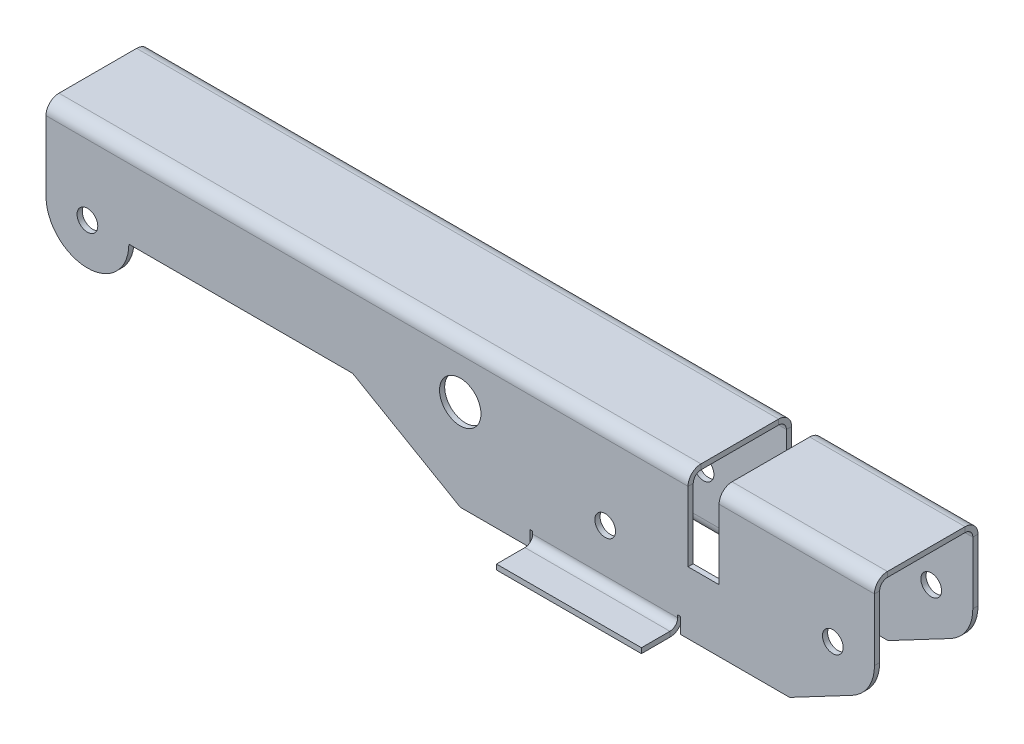
from build123d import *

# Parameters (mm, degrees)
SKETCH1_W                      = 508
SKETCH1_H                      = 63.5
BASE_FLANGE1_DEPTH             = 3.175
EDGE_FLANGE1_STRIP_W           = 22.2504
EDGE_FLANGE1_STRIP_H           = 3.175
EDGE_FLANGE1_STRIP_CUT_DEPTH   = 508
EDGE_FLANGE1_STRIP_2_W         = 22.2504
EDGE_FLANGE1_STRIP_2_H         = 3.175
EDGE_FLANGE1_STRIP_CUT_2_DEPTH = 508
EDGE_FLANGE1_DEPTH             = 508
EDGE_FLANGE1_BEND_DEPTH        = 508
SKETCH12_R                     = 12.7
CUT_EXTRUDE1_DEPTH             = 277.498571425
SKETCH13_R                     = 6.35
CUT_EXTRUDE2_DEPTH             = 277.498571425
CUT_EXTRUDE4_DEPTH             = 277.498571425
SKETCH16_R                     = 6.35
CUT_EXTRUDE5_DEPTH             = 277.498571425
CUT_EXTRUDE6_DEPTH             = 277.498571425
SKETCH18_R                     = 6.35
CUT_EXTRUDE8_DEPTH             = 277.498571425
SKETCH22_W                     = 19.05
SKETCH22_H                     = 50.682224045
CUT_EXTRUDE9_DEPTH             = 277.498571425
EDGE_FLANGE2_STRIP_W           = 22.2504
EDGE_FLANGE2_STRIP_H           = 3.175
EDGE_FLANGE2_STRIP_CUT_DEPTH   = 88.9
EDGE_FLANGE2_RELIEF_W          = 23.8379
EDGE_FLANGE2_RELIEF_H          = 1.5875
EDGE_FLANGE2_RELIEF_CUT_DEPTH  = 3.175
EDGE_FLANGE2_DEPTH             = 88.9


# Sheet-metal steps are written as plain solids
with BuildPart() as part:
    # Sketch1 → Base-Flange1 (new body)
    with BuildSketch(Plane(origin=(0, 0, 0), x_dir=(1, 0, 0), z_dir=(0, 1, 0))):
        Rectangle(SKETCH1_W, SKETCH1_H)
    extrude(amount=-BASE_FLANGE1_DEPTH)

    # Edge-Flange1 strip (across the edge) → Edge-Flange1 strip cut (cut)
    with BuildSketch(Plane(origin=(254, -3.175, 31.75), x_dir=(0, 0, -1), z_dir=(-1, 0, 0))):
        with Locations((-3.175, -1.5875)):
            Rectangle(EDGE_FLANGE1_STRIP_W, EDGE_FLANGE1_STRIP_H)
    extrude(amount=EDGE_FLANGE1_STRIP_CUT_DEPTH, mode=Mode.SUBTRACT)

    # Edge-Flange1 strip 2 (across the edge) → Edge-Flange1 strip cut 2 (cut)
    with BuildSketch(Plane(origin=(-254, -3.175, -31.75), x_dir=(0, 0, 1), z_dir=(1, 0, 0))):
        with Locations((-3.175, -1.5875)):
            Rectangle(EDGE_FLANGE1_STRIP_2_W, EDGE_FLANGE1_STRIP_2_H)
    extrude(amount=EDGE_FLANGE1_STRIP_CUT_2_DEPTH, mode=Mode.SUBTRACT)

    # Edge-Flange1 section (across the edge) → Edge-Flange1 (add)
    with BuildSketch(Plane(origin=(254, -3.175, 31.75), x_dir=(0, 0, -1), z_dir=(-1, 0, 0))):
        with BuildLine():
            Line((0, 4.7752), (0, 85.725))
            Line((0, 85.725), (3.175, 85.725))
            Line((3.175, 85.725), (3.175, 4.7752))
            ThreePointArc((3.175, 4.7752), (4.573623698, 1.398623698), (7.9502, 0))
            Line((7.9502, 0), (7.9502, -3.175))
            ThreePointArc((7.9502, -3.175), (2.328559668, -0.846440332), (0, 4.7752))
        make_face()
    extrude(amount=EDGE_FLANGE1_DEPTH)

    # Edge-Flange1 section 2 (across the edge) → Edge-Flange1 bend (add)
    with BuildSketch(Plane(origin=(-254, -3.175, -31.75), x_dir=(0, 0, 1), z_dir=(1, 0, 0))):
        with BuildLine():
            Line((0, 4.7752), (0, 85.725))
            Line((0, 85.725), (3.175, 85.725))
            Line((3.175, 85.725), (3.175, 4.7752))
            ThreePointArc((3.175, 4.7752), (4.573623698, 1.398623698), (7.9502, 0))
            Line((7.9502, 0), (7.9502, -3.175))
            ThreePointArc((7.9502, -3.175), (2.328559668, -0.846440332), (0, 4.7752))
        make_face()
    extrude(amount=EDGE_FLANGE1_BEND_DEPTH)

    # Sketch12 → Cut-Extrude1 (cut, through all)
    with BuildSketch(Plane.XY.offset(31.75)):
        with Locations((0, -33.02)):
            Circle(SKETCH12_R)
    extrude(amount=-CUT_EXTRUDE1_DEPTH, mode=Mode.SUBTRACT)

    # Sketch13 → Cut-Extrude2 (cut, through all)
    with BuildSketch(Plane.XY.offset(31.75)):
        with Locations((88.9, -54.166128078)):
            Circle(SKETCH13_R)
    extrude(amount=-CUT_EXTRUDE2_DEPTH, mode=Mode.SUBTRACT)

    # Sketch14 → Cut-Extrude4 (cut, through all)
    with BuildSketch(Plane.XY.offset(31.75)):
        with BuildLine():
            Line((-65.991135768, -50.8), (-203.2, -50.8))
            ThreePointArc((-203.2, -50.8), (-228.6, -76.2), (-254, -50.8))
            Line((-254, -50.8), (-254, -88.9))
            Line((-254, -88.9), (0, -88.9))
            Line((0, -88.9), (-65.991135768, -50.8))
        make_face()
    extrude(amount=-CUT_EXTRUDE4_DEPTH, mode=Mode.SUBTRACT)

    # Sketch16 → Cut-Extrude5 (cut, through all)
    with BuildSketch(Plane.XY.offset(31.75)):
        with Locations((-228.6, -50.8)):
            Circle(SKETCH16_R)
    extrude(amount=-CUT_EXTRUDE5_DEPTH, mode=Mode.SUBTRACT)

    # Sketch17 → Cut-Extrude6 (cut, through all)
    with BuildSketch(Plane.XY.offset(31.75)):
        with BuildLine():
            ThreePointArc((254, -46.0375), (250.338556711, -59.209109907), (240.404769023, -68.601518366))
            Line((240.404769023, -68.601518366), (202.003688132, -88.9))
            Line((202.003688132, -88.9), (254, -88.9))
            Line((254, -88.9), (254, -46.0375))
        make_face()
    extrude(amount=-CUT_EXTRUDE6_DEPTH, mode=Mode.SUBTRACT)

    # Sketch18 → Cut-Extrude8 (cut, through all)
    with BuildSketch(Plane.XY.offset(31.75)):
        with Locations((228.477622657, -46.0375)):
            Circle(SKETCH18_R)
    extrude(amount=-CUT_EXTRUDE8_DEPTH, mode=Mode.SUBTRACT)

    # Sketch22 → Cut-Extrude9 (cut, through all)
    with BuildSketch(Plane.XY.offset(31.75)):
        with Locations((149.225, -25.341112023)):
            Rectangle(SKETCH22_W, SKETCH22_H)
    extrude(amount=-CUT_EXTRUDE9_DEPTH, mode=Mode.SUBTRACT)

    # Edge-Flange2 strip (across the edge) → Edge-Flange2 strip cut (cut)
    with BuildSketch(Plane(origin=(133.35, -88.9, -31.75), x_dir=(0, 1, 0), z_dir=(-1, 0, 0))):
        with Locations((-3.175, -1.5875)):
            Rectangle(EDGE_FLANGE2_STRIP_W, EDGE_FLANGE2_STRIP_H)
    edge_flange2_strip_cut = extrude(amount=EDGE_FLANGE2_STRIP_CUT_DEPTH, mode=Mode.SUBTRACT)

    # Edge-Flange2 relief (on the sheet) → Edge-Flange2 relief cut (cut)
    with BuildSketch(Plane(origin=(133.35, -80.9498, -31.75), x_dir=(0, 1, 0), z_dir=(0, 0, -1))):
        with Locations((-10.33145, 0.79375)):
            Rectangle(EDGE_FLANGE2_RELIEF_W, EDGE_FLANGE2_RELIEF_H)
        with Locations((-10.33145, -89.69375)):
            Rectangle(EDGE_FLANGE2_RELIEF_W, EDGE_FLANGE2_RELIEF_H)
    edge_flange2_relief_cut = extrude(amount=-EDGE_FLANGE2_RELIEF_CUT_DEPTH, mode=Mode.SUBTRACT)

    # Edge-Flange2 section (across the edge) → Edge-Flange2 (add)
    with BuildSketch(Plane(origin=(133.35, -88.9, -31.75), x_dir=(0, 1, 0), z_dir=(-1, 0, 0))):
        with BuildLine():
            Line((0, 4.7752), (0, 22.225))
            Line((0, 22.225), (3.175, 22.225))
            Line((3.175, 22.225), (3.175, 4.7752))
            ThreePointArc((3.175, 4.7752), (4.573623698, 1.398623698), (7.9502, 0))
            Line((7.9502, 0), (7.9502, -3.175))
            ThreePointArc((7.9502, -3.175), (2.328559668, -0.846440332), (0, 4.7752))
        make_face()
    edge_flange2 = extrude(amount=EDGE_FLANGE2_DEPTH)

    # Mirror1: Edge-Flange2 strip cut, Edge-Flange2 relief cut, Edge-Flange2 across plane
    add(edge_flange2_strip_cut.mirror(Plane.XY), mode=Mode.SUBTRACT)
    add(edge_flange2_relief_cut.mirror(Plane.XY), mode=Mode.SUBTRACT)
    add(edge_flange2.mirror(Plane.XY))


solid = part.part
